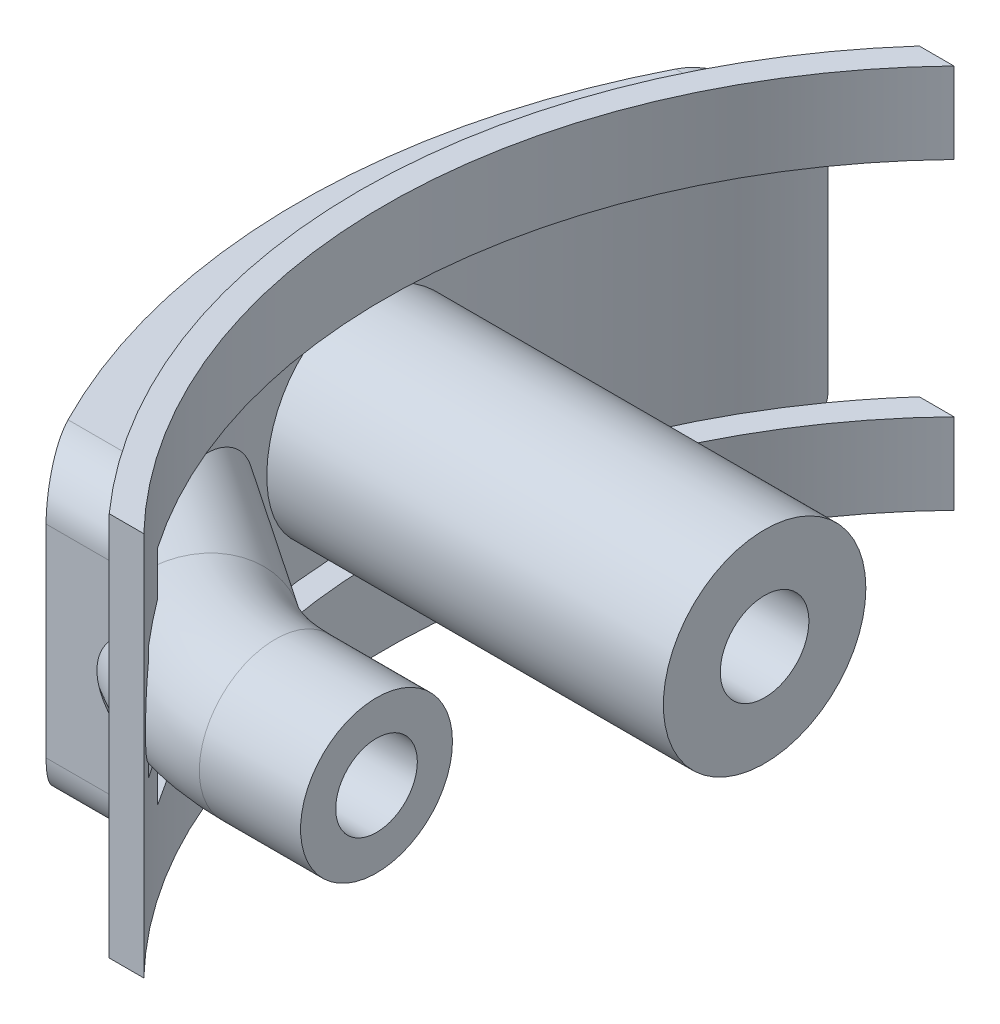
from build123d import *

# Parameters (mm, degrees)
BOSS_EXTRUDE1_DEPTH       = 19.05
BOSS_EXTRUDE1_DEPTH_BACK  = 19.05
BOSS_EXTRUDE11_REACH      = 149.57
BOSS_EXTRUDE11_END_RADIUS = 76.2
BOSS_EXTRUDE11_START      = -50.8
SKETCH14_W                = 101.6
SKETCH14_H                = 10.16
CUT_EXTRUDE1_REACH        = 111.25
BOSS_EXTRUDE12_DEPTH      = 27.94
BOSS_EXTRUDE2_REACH       = 128.339
BOSS_EXTRUDE2_END_RADIUS  = 76.2
BOSS_EXTRUDE2_START       = -25.4
SKETCH2_R                 = 12.7
BOSS_EXTRUDE4_REACH       = 124.529
BOSS_EXTRUDE4_END_RADIUS  = 76.2
BOSS_EXTRUDE4_START       = 21.59
SKETCH7_R                 = 9.525
FILLET2_R                 = 6.35
SKETCH18_R                = 9.525
SKETCH18_R_2              = 5.118758471


with BuildPart() as part:
    # Sketch1 → Boss-Extrude1 (new, two sides: drawn at the far end of the back side and taken through both)
    with BuildSketch(Plane(origin=(0, 0, 0), x_dir=(1, 0, 0), z_dir=(0, 1, 0)).offset(-BOSS_EXTRUDE1_DEPTH_BACK)):
        with BuildLine():
            Line((-71.063280954, 44.45), (-61.89214409, 44.45))
            ThreePointArc((-61.89214409, 44.45), (-76.2, 0), (-61.89214409, -44.45))
            Line((-61.89214409, -44.45), (-71.063280954, -44.45))
            ThreePointArc((-71.063280954, -44.45), (-83.82, 0), (-71.063280954, 44.45))
        make_face()
    extrude(amount=BOSS_EXTRUDE1_DEPTH + BOSS_EXTRUDE1_DEPTH_BACK)

    # Boss-Extrude11: up to this cylinder (the profile starts inside it)
    boss_extrude11_end = Plane(origin=(0, 0, 0), z_dir=(0, 1, 0)) * Cylinder(BOSS_EXTRUDE11_END_RADIUS, 490.64, mode=Mode.PRIVATE)
    # Sketch14 → Boss-Extrude11 (add, up to the surface)
    with BuildSketch(Plane(origin=(0, 0, 0), x_dir=(0, 0, -1), z_dir=(1, 0, 0)).offset(BOSS_EXTRUDE11_START), mode=Mode.PRIVATE) as boss_extrude11_sk1:
        with Locations((0, 19.05)):
            Rectangle(SKETCH14_W, SKETCH14_H)
    boss_extrude11_tool1 = extrude(boss_extrude11_sk1.sketch, amount=-BOSS_EXTRUDE11_REACH, mode=Mode.PRIVATE) & boss_extrude11_end
    add(boss_extrude11_tool1.solids().sort_by_distance((-50.8, 19.05, 0))[0])
    # Sketch14 → Boss-Extrude11 (add, up to the surface)
    with BuildSketch(Plane(origin=(0, 0, 0), x_dir=(0, 0, -1), z_dir=(1, 0, 0)).offset(BOSS_EXTRUDE11_START), mode=Mode.PRIVATE) as boss_extrude11_sk2:
        with Locations((0, -19.05)):
            Rectangle(SKETCH14_W, SKETCH14_H)
    boss_extrude11_tool2 = extrude(boss_extrude11_sk2.sketch, amount=-BOSS_EXTRUDE11_REACH, mode=Mode.PRIVATE) & boss_extrude11_end
    add(boss_extrude11_tool2.solids().sort_by_distance((-50.8, -19.05, 0))[0])

    # Sketch15 → Cut-Extrude1 (cut, up to next)
    with BuildSketch(Plane(origin=(0, 24.13, 0), x_dir=(1, 0, 0), z_dir=(0, 1, 0)), mode=Mode.PRIVATE) as cut_extrude1_sk1:
        with BuildLine():
            Line((-51.636472696, -51.636472696), (-53.881536726, -53.881536726))
            ThreePointArc((-53.881536726, -53.881536726), (76.2, 0), (-53.881536726, 53.881536726))
            Line((-53.881536726, 53.881536726), (-51.636472696, 51.636472696))
            ThreePointArc((-51.636472696, 51.636472696), (-73.025, 0), (-51.636472696, -51.636472696))
        make_face()
    cut_extrude1_tool1 = extrude(cut_extrude1_sk1.sketch, amount=-CUT_EXTRUDE1_REACH, mode=Mode.PRIVATE) & part.part
    cut_extrude1 = cut_extrude1_tool1.solids().sort_by_distance((1.399067, 24.13, 0))[0]
    add(cut_extrude1, mode=Mode.SUBTRACT)

    # Sketch17 → Boss-Extrude12 (add)
    with BuildSketch(Plane.XZ.offset(-13.97)):
        with BuildLine():
            Line((-64.053215181, 41.275), (-60.241389426, 41.275))
            ThreePointArc((-60.241389426, 41.275), (-56.55139427, 46.201628014), (-52.459609463, 50.8))
            Line((-52.459609463, 50.8), (-56.796126628, 50.8))
            ThreePointArc((-56.796126628, 50.8), (-60.612063652, 46.180274358), (-64.053215181, 41.275))
        make_face()
    extrude(amount=BOSS_EXTRUDE12_DEPTH)

    # Mirror4: Cut-Extrude1 across plane
    add(cut_extrude1.mirror(Plane.ZX), mode=Mode.SUBTRACT)

    # Boss-Extrude2: up to this cylinder (the profile starts inside it)
    boss_extrude2_end = Plane(origin=(0, 0, 0), z_dir=(0, 1, 0)) * Cylinder(BOSS_EXTRUDE2_END_RADIUS, 410.078, mode=Mode.PRIVATE)
    # Sketch2 → Boss-Extrude2 (add, up to the surface)
    with BuildSketch(Plane(origin=(0, 0, 0), x_dir=(0, 0, -1), z_dir=(1, 0, 0)).offset(BOSS_EXTRUDE2_START), mode=Mode.PRIVATE) as boss_extrude2_sk1:
        Circle(SKETCH2_R)
    boss_extrude2_tool1 = extrude(boss_extrude2_sk1.sketch, amount=-BOSS_EXTRUDE2_REACH, mode=Mode.PRIVATE) & boss_extrude2_end
    add(boss_extrude2_tool1.solids().sort_by_distance((-25.4, 0, 0))[0])

    # Sketch6 → Cut-Revolve1 (revolve, cut)
    with BuildSketch(Plane(origin=(0, 0, 0), x_dir=(1, 0, 0), z_dir=(0, 1, 0))):
        with BuildLine():
            Line((-25.4, 5.55625), (-51.209495778, 5.55625))
            ThreePointArc((-51.209495778, 5.55625), (-54.496497651, 5.123507994), (-57.559495778, 3.854772628))
            Line((-57.559495778, 3.854772628), (-60.245103339, 2.30423638))
            ThreePointArc((-60.245103339, 2.30423638), (-60.73518304, 2.101238721), (-61.261103339, 2.032))
            ThreePointArc((-61.261103339, 2.032), (-61.658947173, 2.058076063), (-62.049983789, 2.135858081))
            Line((-62.049983789, 2.135858081), (-83.449727621, 7.869902159))
            Line((-83.449727621, 7.869902159), (-83.82, 7.869902159))
            Line((-83.82, 7.869902159), (-83.82, 0))
            Line((-83.82, 0), (-25.4, 0))
            Line((-25.4, 0), (-25.4, 5.55625))
        make_face()
    revolve(axis=Axis((0, 0, 0), (-1, 0, 0)), mode=Mode.SUBTRACT)

    # Boss-Extrude4: up to this cylinder (the profile starts inside it)
    boss_extrude4_end = Plane(origin=(0, 0, 0), z_dir=(0, 1, 0)) * Cylinder(BOSS_EXTRUDE4_END_RADIUS, 402.458, mode=Mode.PRIVATE)
    # Sketch7 → Boss-Extrude4 (add, up to the surface)
    with BuildSketch(Plane(origin=(0, 0, 0), x_dir=(-0.5591929034707508, 0, 0.8290375725550391), z_dir=(-0.8290375725550391, 0, -0.5591929034707508)).offset(BOSS_EXTRUDE4_START), mode=Mode.PRIVATE) as boss_extrude4_sk1:
        with Locations((63.5, 0)):
            Circle(SKETCH7_R)
    boss_extrude4_tool1 = extrude(boss_extrude4_sk1.sketch, amount=BOSS_EXTRUDE4_REACH, mode=Mode.PRIVATE) & boss_extrude4_end
    add(boss_extrude4_tool1.solids().sort_by_distance((-53.407671, 0, 40.570911))[0])

    # Sketch10 → Cut-Revolve2 (revolve, cut)
    with BuildSketch(Plane(origin=(0, 0, 0), x_dir=(1, 0, 0), z_dir=(0, 1, 0)), mode=Mode.PRIVATE) as cut_revolve2_sk:
        with BuildLine():
            Line((-58.70253427, -30.825142062), (-56.238595277, -27.172202281))
            Line((-56.238595277, -27.172202281), (-48.081358156, -32.674328193))
            Line((-48.081358156, -32.674328193), (-53.407670562, -40.570911071))
            Line((-53.407670562, -40.570911071), (-59.773299027, -36.277240457))
            Line((-59.773299027, -36.277240457), (-87.488047317, -17.583406693))
            Line((-87.488047317, -17.583406693), (-83.087253878, -11.05896211))
            Line((-83.087253878, -11.05896211), (-68.552498955, -27.779284981))
            ThreePointArc((-68.552498955, -27.779284981), (-68.271810062, -28.062434097), (-67.956564124, -28.306523581))
            ThreePointArc((-67.956564124, -28.306523581), (-67.414383449, -28.565130498), (-66.820284145, -28.653919234))
            Line((-66.820284145, -28.653919234), (-65.804284145, -28.653919234))
            ThreePointArc((-65.804284145, -28.653919234), (-62.091163495, -29.208848833), (-58.70253427, -30.825142062))
        make_face()
    revolve(cut_revolve2_sk.sketch.rotate(Axis((-87.488047317, 0, 17.583406693), (0.829037572555039, 0, 0.5591929034707509)), 180), axis=Axis((-87.488047317, 0, 17.583406693), (0.829037572555039, 0, 0.5591929034707509)), mode=Mode.SUBTRACT)

    # Fillet2
    # the kernel refuses this fillet: 6.35 mm, written as the material it takes off along each edge
    with BuildSketch(Plane(origin=(-46.01714409, 19.05, 44.45), x_dir=(0, -1, 0), z_dir=(-1, 0, 0))) as fillet2_piece_1_section:
        with BuildLine():
            CenterArc((FILLET2_R, -FILLET2_R), FILLET2_R, 90, 90)
            Line((0, -FILLET2_R), (-FILLET2_R * 0.02, -FILLET2_R))
            Line((-FILLET2_R * 0.02, -FILLET2_R), (-FILLET2_R * 0.02, FILLET2_R * 0.02))
            Line((-FILLET2_R * 0.02, FILLET2_R * 0.02), (FILLET2_R, FILLET2_R * 0.02))
            Line((FILLET2_R, FILLET2_R * 0.02), (FILLET2_R, 0))
        make_face()
    fillet2_piece_1 = extrude(amount=40.921136865, mode=Mode.PRIVATE)
    fillet2_piece_1 = fillet2_piece_1 & Plane(origin=(0, 17.602070234, 0), x_dir=(-0.8478081717295622, 0, 0.5303030303030307), z_dir=(0, -1, 0)) * Cylinder(83.82, 108, mode=Mode.PRIVATE)
    fillet2_piece_1 = fillet2_piece_1 - Plane(origin=(0, 17.602070234, 0), x_dir=(0, 0, 1), z_dir=(0, 1, 0)) * Cylinder(76.2, 108, mode=Mode.PRIVATE)
    add(fillet2_piece_1, mode=Mode.SUBTRACT)
    with BuildSketch(Plane(origin=(-86.938280954, -19.05, -44.45), x_dir=(0, 1, 0), z_dir=(1, 0, 0))) as fillet2_piece_2_section:
        with BuildLine():
            CenterArc((FILLET2_R, FILLET2_R), FILLET2_R, 180, 90)
            Line((0, FILLET2_R), (-FILLET2_R * 0.02, FILLET2_R))
            Line((-FILLET2_R * 0.02, FILLET2_R), (-FILLET2_R * 0.02, -FILLET2_R * 0.02))
            Line((-FILLET2_R * 0.02, -FILLET2_R * 0.02), (FILLET2_R, -FILLET2_R * 0.02))
            Line((FILLET2_R, -FILLET2_R * 0.02), (FILLET2_R, 0))
        make_face()
    fillet2_piece_2 = extrude(amount=40.921136865, mode=Mode.PRIVATE)
    fillet2_piece_2 = fillet2_piece_2 - Plane(origin=(0, -17.602079069, 0), x_dir=(0, 0, 1), z_dir=(0, 1, 0)) * Cylinder(76.2, 108, mode=Mode.PRIVATE)
    fillet2_piece_2 = fillet2_piece_2 & Plane(origin=(0, -17.602079069, 0), x_dir=(-0.8478081717295622, 0, 0.5303030303030307), z_dir=(0, -1, 0)) * Cylinder(83.82, 108, mode=Mode.PRIVATE)
    add(fillet2_piece_2, mode=Mode.SUBTRACT)
    with BuildSketch(Plane(origin=(-86.938280954, 19.05, -44.45), x_dir=(0, -1, 0), z_dir=(1, 0, 0))) as fillet2_piece_3_section:
        with BuildLine():
            CenterArc((FILLET2_R, -FILLET2_R), FILLET2_R, 90, 90)
            Line((0, -FILLET2_R), (-FILLET2_R * 0.02, -FILLET2_R))
            Line((-FILLET2_R * 0.02, -FILLET2_R), (-FILLET2_R * 0.02, FILLET2_R * 0.02))
            Line((-FILLET2_R * 0.02, FILLET2_R * 0.02), (FILLET2_R, FILLET2_R * 0.02))
            Line((FILLET2_R, FILLET2_R * 0.02), (FILLET2_R, 0))
        make_face()
    fillet2_piece_3 = extrude(amount=40.921136865, mode=Mode.PRIVATE)
    fillet2_piece_3 = fillet2_piece_3 - Plane(origin=(0, 17.602079069, 0), x_dir=(0, 0, 1), z_dir=(0, 1, 0)) * Cylinder(76.2, 108, mode=Mode.PRIVATE)
    fillet2_piece_3 = fillet2_piece_3 & Plane(origin=(0, 17.602079069, 0), x_dir=(-0.8478081717295622, 0, 0.5303030303030307), z_dir=(0, -1, 0)) * Cylinder(83.82, 108, mode=Mode.PRIVATE)
    add(fillet2_piece_3, mode=Mode.SUBTRACT)
    with BuildSketch(Plane(origin=(-46.01714409, -19.05, 44.45), x_dir=(0, 1, 0), z_dir=(-1, 0, 0))) as fillet2_piece_4_section:
        with BuildLine():
            CenterArc((FILLET2_R, FILLET2_R), FILLET2_R, 180, 90)
            Line((0, FILLET2_R), (-FILLET2_R * 0.02, FILLET2_R))
            Line((-FILLET2_R * 0.02, FILLET2_R), (-FILLET2_R * 0.02, -FILLET2_R * 0.02))
            Line((-FILLET2_R * 0.02, -FILLET2_R * 0.02), (FILLET2_R, -FILLET2_R * 0.02))
            Line((FILLET2_R, -FILLET2_R * 0.02), (FILLET2_R, 0))
        make_face()
    fillet2_piece_4 = extrude(amount=40.921136865, mode=Mode.PRIVATE)
    fillet2_piece_4 = fillet2_piece_4 & Plane(origin=(0, -17.602070234, 0), x_dir=(-0.8478081717295622, 0, 0.5303030303030307), z_dir=(0, -1, 0)) * Cylinder(83.82, 108, mode=Mode.PRIVATE)
    fillet2_piece_4 = fillet2_piece_4 - Plane(origin=(0, -17.602070234, 0), x_dir=(0, 0, 1), z_dir=(0, 1, 0)) * Cylinder(76.2, 108, mode=Mode.PRIVATE)
    add(fillet2_piece_4, mode=Mode.SUBTRACT)

    # Sweep1: sweep along a path in Sketch8
    with BuildLine(Plane(origin=(0, 0, 0), x_dir=(1, 0, 0), z_dir=(0, 1, 0))) as sweep1_path:
        Line((-34.661407934, -39.411230817), (-47.361407934, -39.411230817))
        ThreePointArc((-47.361407934, -39.411230817), (-54.787649234, -38.301371618), (-61.564907682, -35.06878516))
    # Sketch18 → Sweep1 (sweep)
    with BuildSketch(Plane(origin=(-26.056158312, 0, -17.575100697), x_dir=(0.5591929034707508, 0, -0.8290375725550392), z_dir=(0.8290375725550392, 0, 0.5591929034707508))):
        with Locations((-63.5, 0)):
            Circle(SKETCH18_R)
        with Locations((-63.5, 0)):
            Circle(SKETCH18_R_2, mode=Mode.SUBTRACT)
    sweep(path=sweep1_path.line)


solid = part.part
